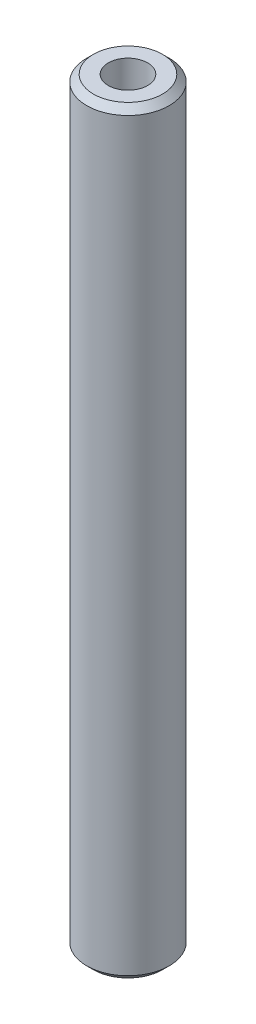
from build123d import *

# Parameters (mm, degrees)
SKETCH1_R           = 5
BOSS_EXTRUDE1_DEPTH = 92.016681747
SKETCH2_R           = 2.3886064
CUT_EXTRUDE1_DEPTH  = 93.287971696
CHAMFER1_SIZE       = 0.810401064


with BuildPart() as part:
    # Sketch1 → Boss-Extrude1 (new body)
    with BuildSketch(Plane(origin=(0, 0, 0), x_dir=(1, 0, 0), z_dir=(0, 1, 0))):
        Circle(SKETCH1_R)
    extrude(amount=BOSS_EXTRUDE1_DEPTH)

    # Sketch2 → Cut-Extrude1 (cut, through all)
    with BuildSketch(Plane(origin=(0, 0, 0), x_dir=(1, 0, 0), z_dir=(0, 1, 0))):
        Circle(SKETCH2_R)
    extrude(amount=CUT_EXTRUDE1_DEPTH, mode=Mode.SUBTRACT)

    # Chamfer1
    chamfer1_edges = [part.edges().sort_by_distance(p)[0] for p in [
        (-5, 92.016681747, 0),
        (-5, 0, 0),
    ]]
    chamfer(chamfer1_edges, length=CHAMFER1_SIZE)


solid = part.part
